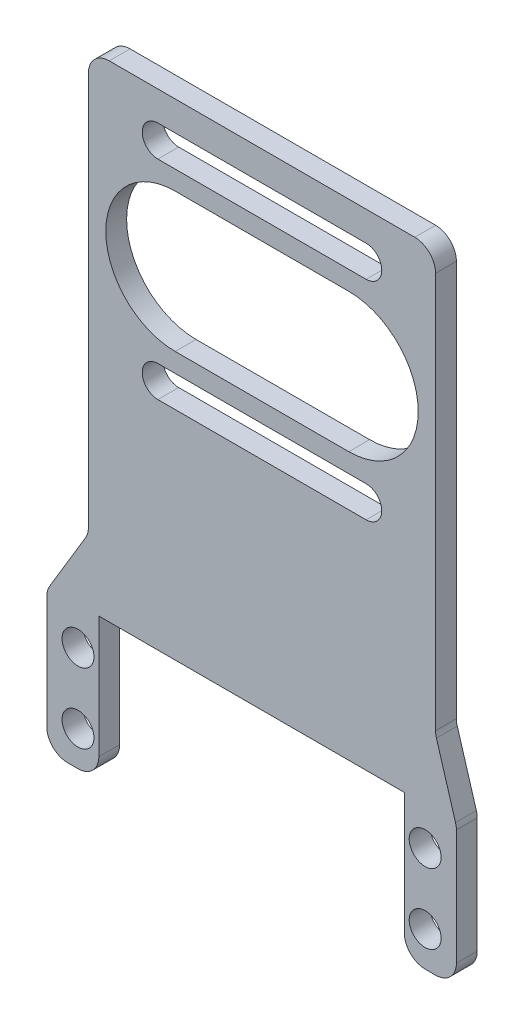
from build123d import *

# Parameters (mm, degrees)
SKETCH1_R           = 2.3
BOSS_EXTRUDE1_DEPTH = 3
FILLET1_R           = 3


with BuildPart() as part:
    # Sketch1 → Boss-Extrude1 (new body)
    with BuildSketch(Plane.XY):
        Polygon((7.5, -20.05), (0, -20.05), (0, 0), (6, 10), (6, 70.5), (56, 70.5), (56, 10), (59, 0), (59, -20.05), (51.5, -20.05), (51.5, 0.5), (7.5, 0.5), align=None)
        with Locations((4.5, -15.05)):
            Circle(SKETCH1_R, mode=Mode.SUBTRACT)
        with Locations((4.5, -4.95)):
            Circle(SKETCH1_R, mode=Mode.SUBTRACT)
        with Locations((54.5, -15.05)):
            Circle(SKETCH1_R, mode=Mode.SUBTRACT)
        with Locations((54.5, -4.95)):
            Circle(SKETCH1_R, mode=Mode.SUBTRACT)
        with BuildLine():
            Line((18.5, 59), (43.5, 59))
            ThreePointArc((43.5, 59), (53.5, 49), (43.5, 39))
            Line((43.5, 39), (18.5, 39))
            ThreePointArc((18.5, 39), (8.5, 49), (18.5, 59))
        make_face(mode=Mode.SUBTRACT)
        with BuildLine():
            Line((16, 66.25), (46, 66.25))
            ThreePointArc((46, 66.25), (48.25, 64), (46, 61.75))
            Line((46, 61.75), (16, 61.75))
            ThreePointArc((16, 61.75), (13.75, 64), (16, 66.25))
        make_face(mode=Mode.SUBTRACT)
        with BuildLine():
            Line((16, 36.25), (46, 36.25))
            ThreePointArc((46, 36.25), (48.25, 34), (46, 31.75))
            Line((46, 31.75), (16, 31.75))
            ThreePointArc((16, 31.75), (13.75, 34), (16, 36.25))
        make_face(mode=Mode.SUBTRACT)
    extrude(amount=BOSS_EXTRUDE1_DEPTH)

    # Fillet1
    fillet1_edges = [part.edges().sort_by_distance(p)[0] for p in [
        (59, -20.05, 1.5),
        (51.5, -20.05, 1.5),
        (7.5, -20.05, 1.5),
        (0, -20.05, 1.5),
        (0, 0, 1.5),
        (6, 10, 1.5),
        (59, 0, 1.5),
        (56, 10, 1.5),
        (6, 70.5, 1.5),
        (56, 70.5, 1.5),
    ]]
    fillet(fillet1_edges, radius=FILLET1_R)


solid = part.part
